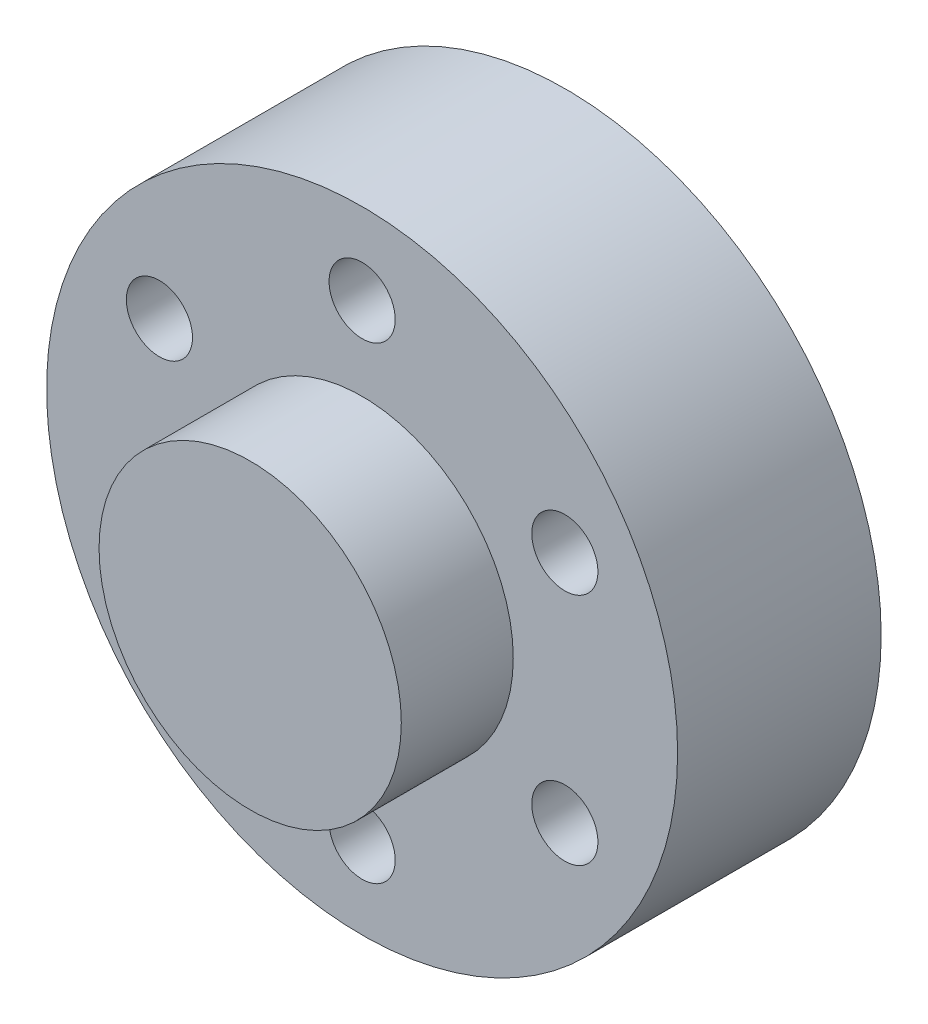
from build123d import *

# Parameters (mm, degrees)
SKETCH2_R           = 15.5
SKETCH2_R_2         = 1.625
BOSS_EXTRUDE1_DEPTH = 10
SKETCH3_R           = 7.425
BOSS_EXTRUDE2_DEPTH = 5.5
BOSS_EXTRUDE4_START = 5.5
SKETCH6_R           = 7.425
BOSS_EXTRUDE4_DEPTH = 5.5
SKETCH7_R           = 2
BOSS_EXTRUDE5_DEPTH = 1
FILLET2_R           = 0.05
CUT_EXTRUDE1_DEPTH  = 11


with BuildPart() as part:
    # Sketch2 → Boss-Extrude1 (new body)
    with BuildSketch(Plane.XY):
        Circle(SKETCH2_R)
        with Locations((0, -11.5)):
            Circle(SKETCH2_R_2, mode=Mode.SUBTRACT)
        with Locations((-9.959292144, -5.75)):
            Circle(SKETCH2_R_2, mode=Mode.SUBTRACT)
        with Locations((9.959292144, -5.75)):
            Circle(SKETCH2_R_2, mode=Mode.SUBTRACT)
        with Locations((-9.959292144, 5.75)):
            Circle(SKETCH2_R_2, mode=Mode.SUBTRACT)
        with Locations((0, 11.5)):
            Circle(SKETCH2_R_2, mode=Mode.SUBTRACT)
        with Locations((9.959292144, 5.75)):
            Circle(SKETCH2_R_2, mode=Mode.SUBTRACT)
    extrude(amount=BOSS_EXTRUDE1_DEPTH)

    # Sketch3 → Boss-Extrude2 (add)
    with BuildSketch(Plane.XY.offset(10)):
        Circle(SKETCH3_R)
    extrude(amount=BOSS_EXTRUDE2_DEPTH)

    # Sketch6 → Boss-Extrude4 (add)
    with BuildSketch(Plane(origin=(0, 0, 0), x_dir=(-1, 0, 0), z_dir=(0, 0, -1)).offset(BOSS_EXTRUDE4_START)):
        Circle(SKETCH6_R)
    extrude(amount=-BOSS_EXTRUDE4_DEPTH)

    # Sketch7 → Boss-Extrude5 (add)
    with BuildSketch(Plane(origin=(0, 0, -5.5), x_dir=(-1, 0, 0), z_dir=(0, 0, -1))):
        Circle(SKETCH7_R)
    extrude(amount=BOSS_EXTRUDE5_DEPTH)

    # Fillet2
    fillet2_edges = [part.edges().sort_by_distance(p)[0] for p in [
        (2, 0, -6.5),
    ]]
    fillet(fillet2_edges, radius=FILLET2_R)

    # Sketch9 → Cut-Extrude1 (cut)
    with BuildSketch(Plane(origin=(0, 0, -6.5), x_dir=(-1, 0, 0), z_dir=(0, 0, -1))):
        with BuildLine():
            Line((-1.224744871, 1.25), (1.224744871, 1.25))
            ThreePointArc((1.224744871, 1.25), (0, -1.75), (-1.224744871, 1.25))
        make_face()
    extrude(amount=-CUT_EXTRUDE1_DEPTH, mode=Mode.SUBTRACT)


solid = part.part
